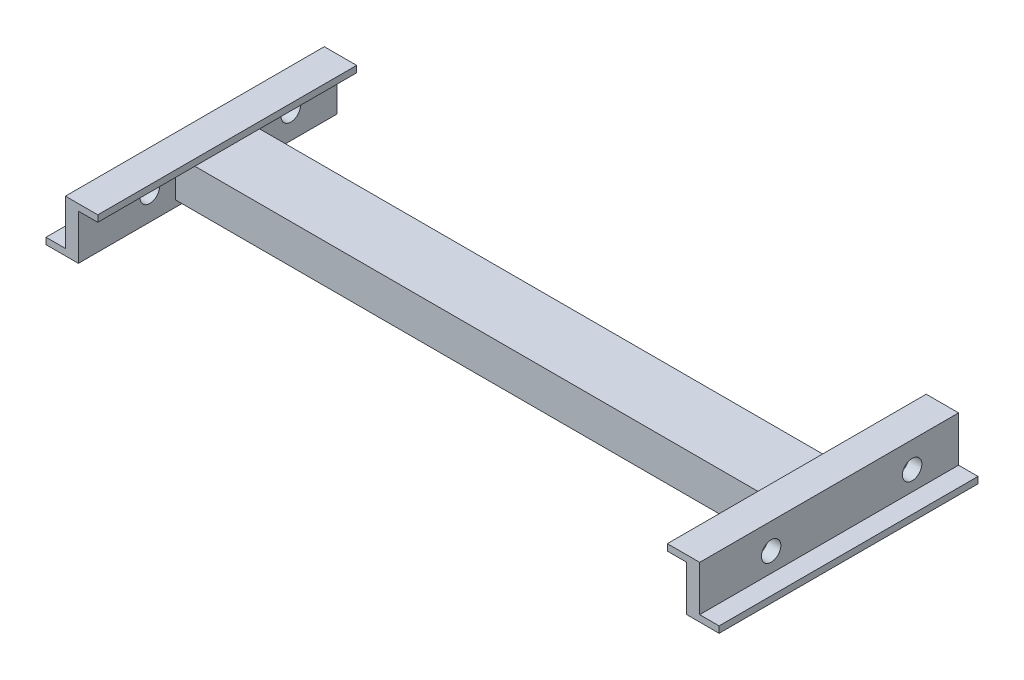
from build123d import *

# Parameters (mm, degrees)
SKETCH1_W           = 400
SKETCH1_H           = 80
BOSS_EXTRUDE1_DEPTH = 20
SKETCH5_W           = 400
SKETCH5_H           = 10
BOSS_EXTRUDE2_DEPTH = 30
SKETCH7_W           = 400
SKETCH7_H           = 10
BOSS_EXTRUDE3_DEPTH = 30
BOSS_EXTRUDE4_START = -20
SKETCH8_W           = 100
SKETCH8_H           = 60
BOSS_EXTRUDE4_DEPTH = 490
SKETCH9_W           = 80
SKETCH9_H           = 50
CUT_EXTRUDE1_DEPTH  = 940
SKETCH11_W          = 80
SKETCH11_H          = 50
BOSS_EXTRUDE5_DEPTH = 20
MIRROR20_START      = -30
MIRROR20_OUTLINE_W  = 490
MIRROR20_OUTLINE_H  = 100
MIRROR20_DEPTH      = 60
SKETCH12_R          = 15
CUT_EXTRUDE2_DEPTH  = 1031.388276331
SKETCH19_R          = 15
CUT_EXTRUDE10_DEPTH = 1031.388276331


# Read off the part's stored shape, not the designer's step: Mirror20
with BuildPart() as part:
    # Sketch1 → Boss-Extrude1 (new body)
    with BuildSketch(Plane(origin=(0, 0, 0), x_dir=(0, 0, -1), z_dir=(1, 0, 0))):
        Rectangle(SKETCH1_W, SKETCH1_H)
    boss_extrude1 = extrude(amount=BOSS_EXTRUDE1_DEPTH)

    # Sketch5 → Boss-Extrude2 (add)
    with BuildSketch(Plane.ZY):
        with Locations((0, 35)):
            Rectangle(SKETCH5_W, SKETCH5_H)
    boss_extrude2 = extrude(amount=BOSS_EXTRUDE2_DEPTH)

    # Sketch7 → Boss-Extrude3 (add)
    with BuildSketch(Plane(origin=(20, 0, 0), x_dir=(0, 0, -1), z_dir=(1, 0, 0))):
        with Locations((0, -35)):
            Rectangle(SKETCH7_W, SKETCH7_H)
    boss_extrude3 = extrude(amount=BOSS_EXTRUDE3_DEPTH)

    # Sketch8 → Boss-Extrude4 (add)
    with BuildSketch(Plane.ZY.offset(BOSS_EXTRUDE4_START)):
        Rectangle(SKETCH8_W, SKETCH8_H)
    extrude(amount=BOSS_EXTRUDE4_DEPTH)

    # Sketch9 → Cut-Extrude1 (cut)
    with BuildSketch(Plane.ZY.offset(470)):
        with Locations((0, -5)):
            Rectangle(SKETCH9_W, SKETCH9_H)
    cut_extrude1 = extrude(amount=-CUT_EXTRUDE1_DEPTH, mode=Mode.SUBTRACT)

    # Sketch11 → Boss-Extrude5 (add)
    with BuildSketch(Plane(origin=(20, 0, 0), x_dir=(0, 0, -1), z_dir=(1, 0, 0))):
        with Locations((0, -5)):
            Rectangle(SKETCH11_W, SKETCH11_H)
    boss_extrude5 = extrude(amount=-BOSS_EXTRUDE5_DEPTH)

    # Mirror20 outline → Mirror20 (add)
    with BuildSketch(Plane(origin=(0, 0, 0), x_dir=(1, 0, 0), z_dir=(0, 1, 0)).offset(MIRROR20_START)):
        with Locations((-715, 0)):
            Rectangle(MIRROR20_OUTLINE_W, MIRROR20_OUTLINE_H)
    extrude(amount=MIRROR20_DEPTH)

    # Mirror22: Boss-Extrude1, Boss-Extrude2, Boss-Extrude3, Cut-Extrude1, Boss-Extrude5 across plane
    add(boss_extrude1.mirror(Plane.ZY.offset(470)))
    add(boss_extrude2.mirror(Plane.ZY.offset(470)))
    add(boss_extrude3.mirror(Plane.ZY.offset(470)))
    add(cut_extrude1.mirror(Plane.ZY.offset(470)), mode=Mode.SUBTRACT)
    add(boss_extrude5.mirror(Plane.ZY.offset(470)))

    # Sketch12 → Cut-Extrude2 (cut, through all)
    with BuildSketch(Plane.ZY.offset(960)):
        with Locations((89.62, 0)):
            Circle(SKETCH12_R)
    extrude(amount=-CUT_EXTRUDE2_DEPTH, mode=Mode.SUBTRACT)

    # Sketch19 → Cut-Extrude10 (cut, through all)
    with BuildSketch(Plane.ZY.offset(960)):
        with Locations((-128.216, 0)):
            Circle(SKETCH19_R)
    extrude(amount=-CUT_EXTRUDE10_DEPTH, mode=Mode.SUBTRACT)


solid = part.part
